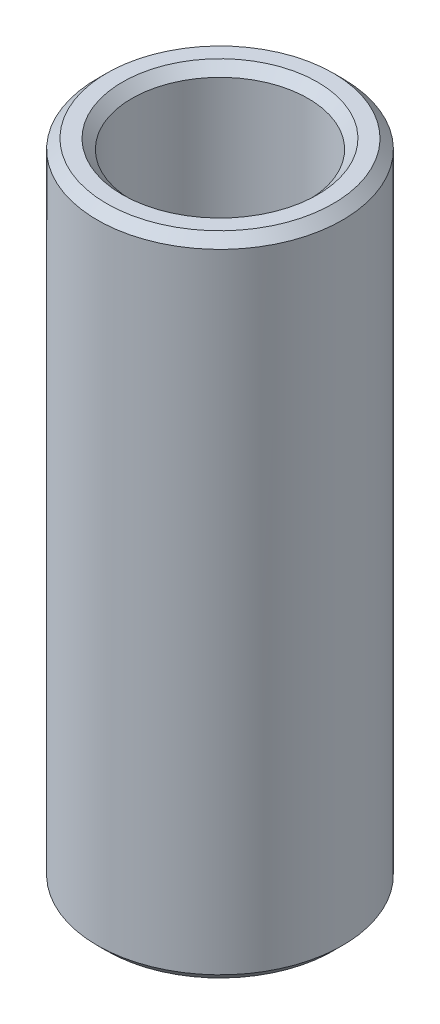
from build123d import *

# Parameters (mm, degrees)
SKETCH1_R           = 45
BOSS_EXTRUDE1_DEPTH = 237.478988636
SKETCH2_R           = 32.350707578
CUT_EXTRUDE1_DEPTH  = 246.858231596
CHAMFER1_SIZE       = 3.46421092


with BuildPart() as part:
    # Sketch1 → Boss-Extrude1 (new body)
    with BuildSketch(Plane(origin=(0, 0, 0), x_dir=(1, 0, 0), z_dir=(0, 1, 0))):
        Circle(SKETCH1_R)
    extrude(amount=BOSS_EXTRUDE1_DEPTH)

    # Sketch2 → Cut-Extrude1 (cut, through all)
    with BuildSketch(Plane(origin=(0, 0, 0), x_dir=(1, 0, 0), z_dir=(0, 1, 0))):
        Circle(SKETCH2_R)
    extrude(amount=CUT_EXTRUDE1_DEPTH, mode=Mode.SUBTRACT)

    # Chamfer1
    chamfer1_edges = [part.edges().sort_by_distance(p)[0] for p in [
        (-32.350707578, 237.478988636, 0),
        (-32.350707578, 0, 0),
        (-45, 0, 0),
        (-45, 237.478988636, 0),
    ]]
    chamfer(chamfer1_edges, length=CHAMFER1_SIZE)


solid = part.part
